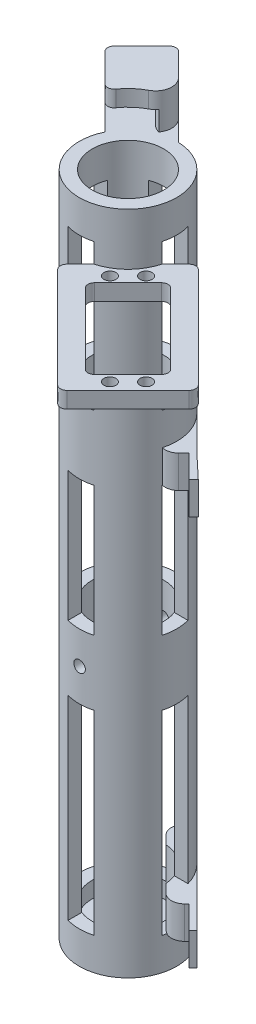
from build123d import *

# Parameters (mm, degrees)
SKETCH1_R                            = 19.05
SKETCH1_R_2                          = 13.97
BOSS_EXTRUDE1_DEPTH                  = 260.35
SKETCH2_R                            = 13.97
BOSS_EXTRUDE2_DEPTH                  = 6.35
CUT_EXTRUDE1_DEPTH                   = 264.45690084
CUT_EXTRUDE1_DEPTH_BACK              = 264.45690084
SKETCH3_R                            = 2.2479
CUT_EXTRUDE5_DEPTH                   = 262.740190953
CUT_EXTRUDE5_DEPTH_BACK              = 262.740190953
SKETCH5_W                            = 10.16
SKETCH5_H                            = 76.2
SKETCH5_H_2                          = 50.8
SKETCH5_H_3                          = 57.15
CUT_EXTRUDE6_DEPTH                   = 262.740190953
CUT_EXTRUDE6_DEPTH_BACK              = 262.740190953
SKETCH8_W                            = 10.16
SKETCH8_H                            = 76.2
SKETCH8_H_2                          = 50.8
SKETCH8_H_3                          = 57.15
SKETCH7_R                            = 6.35
CUT_EXTRUDE4_DEPTH                   = 256.424754201
SKETCH9_W                            = 38.862
SKETCH9_H                            = 6.35
BOSS_EXTRUDE3_DEPTH                  = 8.89
SKETCH10_W                           = 7.62
SKETCH10_H                           = 6.35
BOSS_EXTRUDE4_DEPTH                  = 51.562
BOSS_EXTRUDE5_REACH                  = 279.895
SKETCH11_W                           = 7.62
SKETCH11_H                           = 6.35
FILLET1_R                            = 2.54
CUT_EXTRUDE7_REACH                   = 260.109
SKETCH12_R                           = 2.35585
SKETCH17_W                           = 20.32
SKETCH17_H                           = 6.35
BOSS_EXTRUDE6_DEPTH                  = 20.32
BOSS_EXTRUDE6_DIRECTION_2_REACH      = 286.223
BOSS_EXTRUDE6_DIRECTION_2_END_RADIUS = 19.05
BOSS_EXTRUDE8_DEPTH                  = 13.97
CUT_EXTRUDE8_START                   = -13.97
CUT_EXTRUDE8_DEPTH                   = 7.62
FILLET3_R                            = 2.54
FILLET4_R                            = 6.35
BOSS_EXTRUDE10_DEPTH                 = 12.7
FILLET5_R                            = 5.08
SKETCH24_R                           = 2.54
CUT_EXTRUDE12_DEPTH                  = 2.54
SKETCH25_R                           = 2.54
CUT_EXTRUDE13_DEPTH                  = 2.54
BOSS_EXTRUDE11_DEPTH                 = 12.7
FILLET6_R                            = 5.08
SKETCH27_R                           = 2.54
CUT_EXTRUDE14_DEPTH                  = 12.7


with BuildPart() as part:
    # Sketch1 → Boss-Extrude1 (new body)
    with BuildSketch(Plane(origin=(0, 0, 0), x_dir=(1, 0, 0), z_dir=(0, 1, 0))):
        with Locations(Location((0, 0, 0), (0, 0, 270))):
            Circle(SKETCH1_R)
        with Locations(Location((0, 0, 0), (0, 0, 270))):
            Circle(SKETCH1_R_2, mode=Mode.SUBTRACT)
    extrude(amount=BOSS_EXTRUDE1_DEPTH)

    # Sketch2 → Boss-Extrude2 (add)
    with BuildSketch(Plane.XZ):
        with Locations(Location((0, 0, 0), (0, 0, 270))):
            Circle(SKETCH2_R)
    extrude(amount=-BOSS_EXTRUDE2_DEPTH)

    # Sketch3 → Cut-Extrude1 (cut, two sides: drawn at the far end of the back side and taken through both)
    with BuildSketch(Plane.XY.offset(16.51).offset(-CUT_EXTRUDE1_DEPTH_BACK)):
        with Locations((0, 101.6)):
            Circle(SKETCH3_R)
    extrude(amount=CUT_EXTRUDE1_DEPTH + CUT_EXTRUDE1_DEPTH_BACK, mode=Mode.SUBTRACT)

    # Sketch5 → Cut-Extrude5 (cut, two sides: drawn at the far end of the back side and taken through both)
    with BuildSketch(Plane(origin=(0, 0, 0), x_dir=(0, 0, -1), z_dir=(1, 0, 0)).offset(-CUT_EXTRUDE5_DEPTH_BACK)):
        with Locations((0, 50.8)):
            Rectangle(SKETCH5_W, SKETCH5_H)
        with Locations((0, 139.7)):
            Rectangle(SKETCH5_W, SKETCH5_H_2)
        with Locations((0, 219.075)):
            Rectangle(SKETCH5_W, SKETCH5_H_3)
    extrude(amount=CUT_EXTRUDE5_DEPTH + CUT_EXTRUDE5_DEPTH_BACK, mode=Mode.SUBTRACT)

    # Sketch8 → Cut-Extrude6 (cut, two sides: drawn at the far end of the back side and taken through both)
    with BuildSketch(Plane.XY.offset(-CUT_EXTRUDE6_DEPTH_BACK)):
        with Locations((0, 50.8)):
            Rectangle(SKETCH8_W, SKETCH8_H)
        with Locations((0, 139.7)):
            Rectangle(SKETCH8_W, SKETCH8_H_2)
        with Locations((0, 219.075)):
            Rectangle(SKETCH8_W, SKETCH8_H_3)
    extrude(amount=CUT_EXTRUDE6_DEPTH + CUT_EXTRUDE6_DEPTH_BACK, mode=Mode.SUBTRACT)

    # Sketch7 → Cut-Extrude4 (cut, through all)
    with BuildSketch(Plane(origin=(0, 6.35, 0), x_dir=(1, 0, 0), z_dir=(0, 1, 0))):
        with Locations(Location((0, 0, 0), (0, 0, 270))):
            Circle(SKETCH7_R)
    extrude(amount=-CUT_EXTRUDE4_DEPTH, mode=Mode.SUBTRACT)

    # Sketch9 → Boss-Extrude3 (add)
    with BuildSketch(Plane(origin=(11.720088507, 0, 11.720088507), x_dir=(0.7071067811865485, 0, -0.7071067811865467), z_dir=(0.7071067811865467, 0, 0.7071067811865485))):
        with Locations((0, 236.827)):
            Rectangle(SKETCH9_W, SKETCH9_H)
    extrude(amount=BOSS_EXTRUDE3_DEPTH)

    # Sketch10 → Boss-Extrude4 (add)
    with BuildSketch(Plane(origin=(18.006267792, 0, 18.006267792), x_dir=(0.7071067811865481, 0, -0.707106781186547), z_dir=(0.707106781186547, 0, 0.7071067811865481))):
        with Locations((-15.621, 236.827)):
            Rectangle(SKETCH10_W, SKETCH10_H)
        with Locations((15.621, 236.827)):
            Rectangle(SKETCH10_W, SKETCH10_H)
    extrude(amount=BOSS_EXTRUDE4_DEPTH)

    # Sketch11 → Boss-Extrude5 (add, up to next)
    with BuildSketch(Plane(origin=(-8.351638193, 0, 8.351638193), x_dir=(-0.7071067811865471, 0, -0.7071067811865479), z_dir=(0.7071067811865479, 0, -0.7071067811865471)), mode=Mode.PRIVATE) as boss_extrude5_sk1:
        with Locations((-73.216708119, 236.827)):
            Rectangle(SKETCH11_W, SKETCH11_H)
    boss_extrude5_tool1 = extrude(boss_extrude5_sk1.sketch, amount=BOSS_EXTRUDE5_REACH, mode=Mode.PRIVATE) - part.part
    add(boss_extrude5_tool1.solids().sort_by_distance((43.420393, 236.827, 60.123669))[0])

    # Fillet1
    fillet1_edges = [part.edges().sort_by_distance(p)[0] for p in [
        (-2.019703358, 236.827, 25.459880372),
        (25.459880372, 236.827, -2.019703358),
        (9.654629599, 236.827, 26.357905985),
        (40.726315778, 236.827, 68.205899509),
        (26.357905985, 236.827, 9.654629599),
        (68.205899509, 236.827, 40.726315778),
        (57.429592163, 236.827, 40.726315778),
        (40.726315778, 236.827, 57.429592163),
    ]]
    fillet(fillet1_edges, radius=FILLET1_R)

    # Sketch12 → Cut-Extrude7 (cut, up to next)
    with BuildSketch(Plane(origin=(0, 240.002, 0), x_dir=(1, 0, 0), z_dir=(0, 1, 0)), mode=Mode.PRIVATE) as cut_extrude7_sk1:
        with Locations(Location((48.033763646, -55.104831458, 0), (0, 0, 270))):
            Circle(SKETCH12_R)
    cut_extrude7_tool1 = extrude(cut_extrude7_sk1.sketch, amount=-CUT_EXTRUDE7_REACH, mode=Mode.PRIVATE) & part.part
    # Sketch12 → Cut-Extrude7 (cut, up to next)
    with BuildSketch(Plane(origin=(0, 240.002, 0), x_dir=(1, 0, 0), z_dir=(0, 1, 0)), mode=Mode.PRIVATE) as cut_extrude7_sk2:
        with Locations(Location((55.104831458, -48.033763646, 0), (0, 0, 270))):
            Circle(SKETCH12_R)
    cut_extrude7_tool2 = extrude(cut_extrude7_sk2.sketch, amount=-CUT_EXTRUDE7_REACH, mode=Mode.PRIVATE) & part.part
    # Sketch12 → Cut-Extrude7 (cut, up to next)
    with BuildSketch(Plane(origin=(0, 240.002, 0), x_dir=(1, 0, 0), z_dir=(0, 1, 0)), mode=Mode.PRIVATE) as cut_extrude7_sk3:
        with Locations(Location((19.254517652, -12.18344984, 0), (0, 0, 270))):
            Circle(SKETCH12_R)
    cut_extrude7_tool3 = extrude(cut_extrude7_sk3.sketch, amount=-CUT_EXTRUDE7_REACH, mode=Mode.PRIVATE) & part.part
    # Sketch12 → Cut-Extrude7 (cut, up to next)
    with BuildSketch(Plane(origin=(0, 240.002, 0), x_dir=(1, 0, 0), z_dir=(0, 1, 0)), mode=Mode.PRIVATE) as cut_extrude7_sk4:
        with Locations(Location((12.18344984, -19.254517652, 0), (0, 0, 270))):
            Circle(SKETCH12_R)
    cut_extrude7_tool4 = extrude(cut_extrude7_sk4.sketch, amount=-CUT_EXTRUDE7_REACH, mode=Mode.PRIVATE) & part.part
    add(cut_extrude7_tool1.solids().sort_by_distance((48.033764, 240.002, 55.104831))[0], mode=Mode.SUBTRACT)
    add(cut_extrude7_tool2.solids().sort_by_distance((55.104831, 240.002, 48.033764))[0], mode=Mode.SUBTRACT)
    add(cut_extrude7_tool3.solids().sort_by_distance((19.254518, 240.002, 12.18345))[0], mode=Mode.SUBTRACT)
    add(cut_extrude7_tool4.solids().sort_by_distance((12.18345, 240.002, 19.254518))[0], mode=Mode.SUBTRACT)

    # Sketch17 → Boss-Extrude6 (add)
    with BuildSketch(Plane(origin=(-13.470384182, 0, -13.470384182), x_dir=(-0.707106781186548, 0, 0.7071067811865471), z_dir=(-0.7071067811865471, 0, -0.707106781186548))):
        with Locations((-3.81, 257.175)):
            Rectangle(SKETCH17_W, SKETCH17_H)
    extrude(amount=BOSS_EXTRUDE6_DEPTH)

    # Boss-Extrude6 direction 2: up to this cylinder (the profile starts outside it)
    boss_extrude6_direction_2_end = Plane(origin=(0, 257.175, 0), z_dir=(0, -1, 0)) * Cylinder(BOSS_EXTRUDE6_DIRECTION_2_END_RADIUS, 611.546, mode=Mode.PRIVATE)
    # Sketch17 → Boss-Extrude6 direction 2 (add, up to the surface)
    with BuildSketch(Plane(origin=(-13.470384182, 0, -13.470384182), x_dir=(-0.707106781186548, 0, 0.7071067811865471), z_dir=(-0.7071067811865471, 0, -0.707106781186548)), mode=Mode.PRIVATE) as boss_extrude6_direction_2_sk1:
        with Locations((-3.81, 257.175)):
            Rectangle(SKETCH17_W, SKETCH17_H)
    boss_extrude6_direction_2_tool1 = extrude(boss_extrude6_direction_2_sk1.sketch, amount=-BOSS_EXTRUDE6_DIRECTION_2_REACH, mode=Mode.PRIVATE) - boss_extrude6_direction_2_end
    add(boss_extrude6_direction_2_tool1.solids().sort_by_distance((-10.776307, 257.175, -16.164461))[0])
    add(boss_extrude6_direction_2_tool1.solids().sort_by_distance((-10.776307, 257.175, -16.164461))[1])

    # Sketch20 → Boss-Extrude8 (add)
    with BuildSketch(Plane(origin=(0, 260.35, 0), x_dir=(1, 0, 0), z_dir=(0, 1, 0))):
        with BuildLine():
            Line((0.720181493, 19.036381973), (-17.960512242, 37.717075708))
            Line((-17.960512242, 37.717075708), (-32.328922036, 23.348665915))
            Line((-32.328922036, 23.348665915), (-17.190128061, 8.209871939))
            ThreePointArc((-17.190128061, 8.209871939), (-9.854852351, 16.302894993), (0.720181493, 19.036381973))
        make_face()
    extrude(amount=BOSS_EXTRUDE8_DEPTH)

    # Sketch21 → Cut-Extrude8 (cut)
    with BuildSketch(Plane(origin=(0, 274.32, 0), x_dir=(1, 0, 0), z_dir=(0, 1, 0)).offset(CUT_EXTRUDE8_START)):
        with BuildLine():
            Line((-27.838793975, 18.858537854), (-17.960512242, 28.736819587))
            Line((-17.960512242, 28.736819587), (-6.957657358, 17.733964703))
            ThreePointArc((-6.957657358, 17.733964703), (-12.979058937, 13.944408525), (-17.190128061, 8.209871939))
            Line((-17.190128061, 8.209871939), (-27.838793975, 18.858537854))
        make_face()
    extrude(amount=CUT_EXTRUDE8_DEPTH, mode=Mode.SUBTRACT)

    # Fillet3
    # the kernel refuses this fillet: 2.54 mm, written as the material it takes off along each edge
    with BuildSketch(Plane(origin=(-32.328922036, 260.35, -23.348665915), x_dir=(0.7071067811865468, 0, 0.7071067811865482), z_dir=(0, 1, 0))) as fillet3_piece_1:
        with BuildLine():
            CenterArc((FILLET3_R, FILLET3_R), FILLET3_R, 180, 90)
            Line((0, FILLET3_R), (0, 0))
            Line((0, 0), (FILLET3_R, 0))
        make_face()
    extrude(amount=20.32, mode=Mode.SUBTRACT)
    with BuildSketch(Plane(origin=(-17.960512242, 260.35, -37.717075708), x_dir=(0.7071067811865469, 0, 0.7071067811865482), z_dir=(0, 1, 0))) as fillet3_piece_2:
        with BuildLine():
            CenterArc((FILLET3_R, -FILLET3_R), FILLET3_R, 90, 90)
            Line((0, -FILLET3_R), (0, 0))
            Line((0, 0), (FILLET3_R, 0))
        make_face()
    extrude(amount=20.32, mode=Mode.SUBTRACT)
    with BuildSketch(Plane(origin=(-17.190128061, 267.97, -8.209871939), x_dir=(0.5027524055877951, 0, -0.8644304591323035), z_dir=(0, 1, 0))) as fillet3_piece_3:
        with BuildLine():
            CenterArc((3.297098378, 2.531627088), FILLET3_R, 165.182265372, 100.164248622)
            Line((0.84156792, 3.181219399), (0, 0))
            ThreePointArc((0, 0), (1.545514865, 0.062796841), (3.091029729, 0))
        make_face()
    extrude(amount=14.57663108, mode=Mode.SUBTRACT)
    with BuildSketch(Plane(origin=(-27.838793975, 260.35, -18.858537854), x_dir=(-0.707106781186549, 0, -0.7071067811865461), z_dir=(0, 1, 0))) as fillet3_piece_4:
        with BuildLine():
            CenterArc((FILLET3_R, -FILLET3_R), FILLET3_R, 90, 90)
            Line((0, -FILLET3_R), (0, 0))
            Line((0, 0), (FILLET3_R, 0))
        make_face()
    extrude(amount=7.62, mode=Mode.SUBTRACT)
    with BuildSketch(Plane(origin=(-17.960512242, 260.35, -37.717075708), x_dir=(0.7071067811865461, 0, 0.7071067811865489), z_dir=(0, -1, 0)), Plane(origin=(-32.328922036, 247.65, -23.348665915), x_dir=(0.7071067811865475, 0, 0.7071067811865475), z_dir=(0, 1, 0))) as fillet3_piece_5:
        with BuildLine():
            CenterArc((FILLET3_R, FILLET3_R), FILLET3_R, 180, 90)
            Line((0, FILLET3_R), (0, 0))
            Line((0, 0), (FILLET3_R, 0))
        make_face()
    extrude(amount=12.7, mode=Mode.SUBTRACT)

    # Fillet4
    # the kernel refuses this fillet: 6.35 mm, written as the material it takes off along each edge
    with BuildSketch(Plane(origin=(-6.957657358, 260.35, -17.733964703), x_dir=(0.9586837821239451, 0, -0.28447391074143913), z_dir=(0, 1, 0))) as fillet4_piece_1:
        with BuildLine():
            CenterArc((3.79246695, 6.326845451), FILLET4_R, 208.472595724, 56.632987031)
            Line((-1.789470291, 3.299556788), (0, 0))
            ThreePointArc((0, 0), (1.625342978, 0.069463648), (3.250685957, 0))
        make_face()
    extrude(amount=7.62, mode=Mode.SUBTRACT)
    with BuildSketch(Plane(origin=(0.720181493, 260.35, -19.036381973), x_dir=(-0.9755809025693717, 0, 0.2196403936937157), z_dir=(0, 1, 0))) as fillet4_piece_2:
        with BuildLine():
            CenterArc((11.395425399, -6.137783253), FILLET4_R, 104.854484405, 107.457603124)
            Line((6.028728718, -9.532052944), (0, 0))
            ThreePointArc((0, 0), (4.883753742, -0.63665024), (9.767507485, 0))
        make_face()
    extrude(amount=42.166365379, mode=Mode.SUBTRACT)

    # Sketch23 → Boss-Extrude10 (add)
    with BuildSketch(Plane(origin=(0, 177.8, 0), x_dir=(-1, 0, 0), z_dir=(0, -1, 0))):
        with BuildLine():
            Line((-26.940768363, 0), (0, 26.940768363))
            Line((0, 26.940768363), (8.980256121, 35.921024484))
            Line((8.980256121, 35.921024484), (10.776307345, 34.12497326))
            Line((10.776307345, 34.12497326), (1.796051224, 25.144717139))
            Line((1.796051224, 25.144717139), (6.735192091, 20.205576272))
            Line((6.735192091, 20.205576272), (1.133744752, 14.604128934))
            ThreePointArc((1.133744752, 14.604128934), (-10.357749733, 10.357749733), (-14.604128934, -1.133744752))
            Line((-14.604128934, -1.133744752), (-20.205576272, -6.735192091))
            Line((-20.205576272, -6.735192091), (-25.414933228, -1.525835136))
            Line((-25.414933228, -1.525835136), (-34.44502886, -10.555930768))
            Line((-34.44502886, -10.555930768), (-36.186390143, -8.706806413))
            Line((-36.186390143, -8.706806413), (-26.940768363, 0))
        make_face()
    extrude(amount=BOSS_EXTRUDE10_DEPTH)

    # Fillet5
    # the kernel refuses this fillet: 5.08 mm, written as the material it takes off along each edge
    with BuildSketch(Plane(origin=(-6.735192091, 188.816098544, -20.205576272), x_dir=(0.7071067811865518, 0, 0.7071067811865431), z_dir=(0, -1, 0))) as fillet5_piece_1:
        with BuildLine():
            CenterArc((5.08, -4.406439418), FILLET5_R, 119.84103108, 60.15896892)
            Line((0, -4.406439418), (-0.1016, -4.406439418))
            Line((-0.1016, -4.406439418), (-0.1016, 0))
            Line((-0.1016, 0), (0, 0.1016))
            ThreePointArc((0, 0.1016), (1.276108029, 0.1016), (2.501660379, 0.088128788))
            Line((2.501660379, 0.088128788), (2.552216058, 0))
        make_face()
    extrude(amount=34.732197089, mode=Mode.SUBTRACT)
    with BuildSketch(Plane(origin=(20.205576272, 188.816098544, 6.735192091), x_dir=(-0.7071067811864926, 0, -0.7071067811866023), z_dir=(0, -1, 0))) as fillet5_piece_2:
        with BuildLine():
            CenterArc((5.08, 4.406439418), FILLET5_R, 180, 60.15896892)
            Line((0, 4.406439418), (-0.1016, 4.406439418))
            Line((-0.1016, 4.406439418), (-0.1016, 0))
            Line((-0.1016, 0), (0, -0.1016))
            ThreePointArc((0, -0.1016), (1.276108029, -0.1016), (2.501660379, -0.088128788))
            Line((2.501660379, -0.088128788), (2.552216058, 0))
        make_face()
    extrude(amount=34.732197089, mode=Mode.SUBTRACT)

    # Sketch24 → Cut-Extrude12 (cut)
    with BuildSketch(Plane(origin=(12.662524913, 0, -13.44613749), x_dir=(-0.7280017149438149, 0, -0.6855753080726177), z_dir=(0.6855753080726177, 0, -0.7280017149438149))):
        with Locations((-26.136880936, 171.226212418)):
            Circle(SKETCH24_R)
    extrude(amount=-CUT_EXTRUDE12_DEPTH, mode=Mode.SUBTRACT)

    # Sketch25 → Cut-Extrude13 (cut)
    with BuildSketch(Plane(origin=(11.674332957, 0, -11.674332957), x_dir=(0.7071067811865472, 0, 0.7071067811865479), z_dir=(-0.7071067811865479, 0, 0.7071067811865472))):
        with Locations((-24.977534971, 171.463603503)):
            Circle(SKETCH25_R)
    extrude(amount=-CUT_EXTRUDE13_DEPTH, mode=Mode.SUBTRACT)

    # Sketch26 → Boss-Extrude11 (add)
    with BuildSketch(Plane(origin=(0, 25.130000032, 0), x_dir=(-1, 0, 0), z_dir=(0, -1, 0))):
        with BuildLine():
            Line((-35.921024484, -8.980256121), (8.980256121, 35.921024484))
            Line((8.980256121, 35.921024484), (9.035619543, 35.973167506))
            Line((9.035619543, 35.973167506), (10.776307345, 34.12497326))
            Line((10.776307345, 34.12497326), (1.485481516, 25.374579608))
            Line((1.485481516, 25.374579608), (6.000529332, 20.859531791))
            Line((6.000529332, 20.859531791), (-0.920569112, 13.938433347))
            ThreePointArc((-0.920569112, 13.938433347), (-9.87743316, 9.87743316), (-13.938433347, 0.920569112))
            Line((-13.938433347, 0.920569112), (-20.899885411, -6.040882952))
            Line((-20.899885411, -6.040882952), (-25.414933228, -1.525835136))
            Line((-25.414933228, -1.525835136), (-34.44502886, -10.555930768))
            Line((-34.44502886, -10.555930768), (-35.921024484, -8.980256121))
        make_face()
    extrude(amount=BOSS_EXTRUDE11_DEPTH)

    # Fillet6
    fillet6_edges = [part.edges().sort_by_distance(p)[0] for p in [
        (-6.000529332, 18.780000032, -20.859531791),
        (20.899885411, 18.780000032, 6.040882952),
    ]]
    fillet(fillet6_edges, radius=FILLET6_R)

    # Sketch27 → Cut-Extrude14 (cut)
    with BuildSketch(Plane(origin=(13.470384182, 0, -13.470384182), x_dir=(-0.7071067811865472, 0, -0.7071067811865479), z_dir=(0.7071067811865479, 0, -0.7071067811865472))):
        with Locations((-25.470483714, 18.780000032)):
            Circle(SKETCH27_R)
        with Locations((25.4, 18.780000032)):
            Circle(SKETCH27_R)
    extrude(amount=-CUT_EXTRUDE14_DEPTH, mode=Mode.SUBTRACT)


solid = part.part
